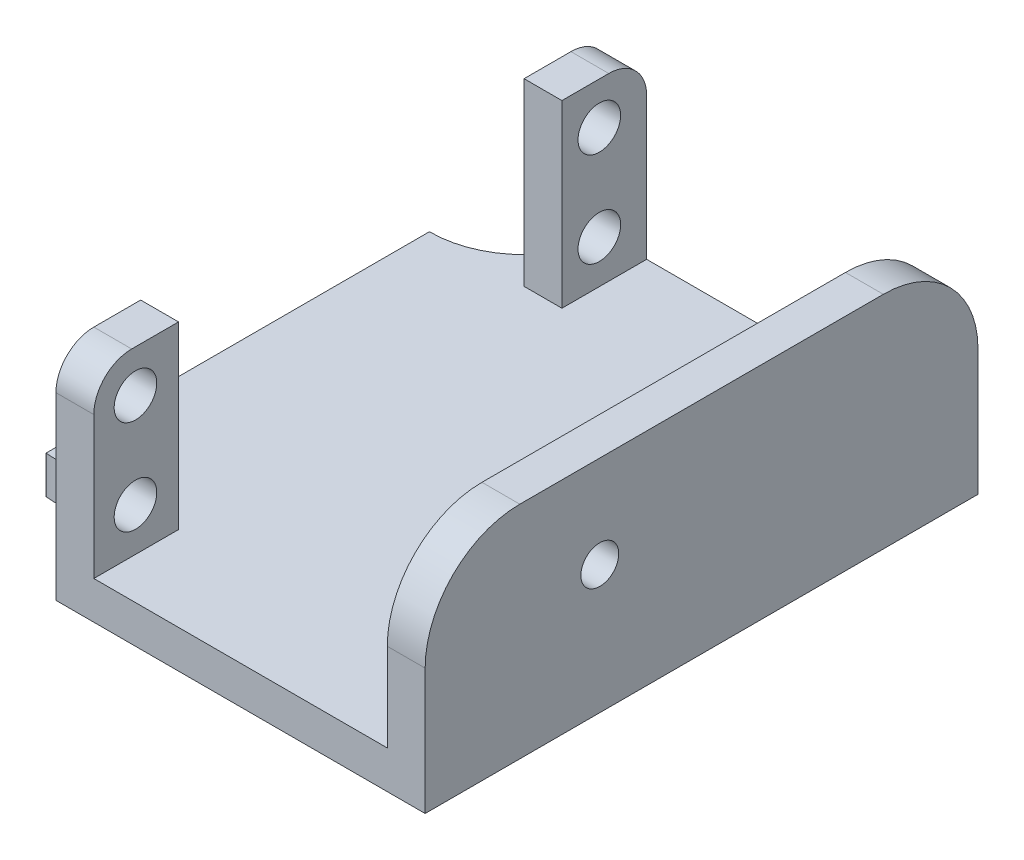
from build123d import *

# Parameters (mm, degrees)
BOSS_EXTRUDE1_DEPTH = 4
SKETCH2_W           = 8.95
SKETCH2_H           = 19
SKETCH2_R           = 2.25
BOSS_EXTRUDE2_DEPTH = 4
FILLET1_R           = 10
FILLET2_R           = 4
SKETCH3_W           = 58.4
SKETCH3_H           = 19.3
SKETCH3_R           = 2
BOSS_EXTRUDE3_DEPTH = 4
FILLET3_R           = 10


with BuildPart() as part:
    # Sketch1 → Boss-Extrude1 (new body)
    with BuildSketch(Plane(origin=(0, 0, 0), x_dir=(1, 0, 0), z_dir=(0, 1, 0))):
        Polygon((-49, 49.45), (-39, 49.45), (-39, 58.4), (0, 58.4), (0, 0), (-39, 0), (-39, 8.95), (-49, 8.95), align=None)
    extrude(amount=BOSS_EXTRUDE1_DEPTH)

    # Sketch2 → Boss-Extrude2 (add)
    # profile 1 of 2: a face of its own
    with BuildSketch(Plane.ZY.offset(39)):
        with Locations((-4.475, 13.5)):
            Rectangle(SKETCH2_W, SKETCH2_H)
        with Locations((-4.4, 18.55)):
            Circle(SKETCH2_R, mode=Mode.SUBTRACT)
        with Locations((-4.4, 8.55)):
            Circle(SKETCH2_R, mode=Mode.SUBTRACT)
    # profile 2 of 2: a face of its own
    with BuildSketch(Plane.ZY.offset(39)):
        with Locations((-53.925, 13.5)):
            Rectangle(SKETCH2_W, SKETCH2_H)
        with Locations((-53.4, 18.55)):
            Circle(SKETCH2_R, mode=Mode.SUBTRACT)
        with Locations((-53.4, 8.55)):
            Circle(SKETCH2_R, mode=Mode.SUBTRACT)
    extrude(amount=-BOSS_EXTRUDE2_DEPTH)

    # Fillet1
    # the kernel refuses this fillet: 10 mm, written as the material it adds along each edge
    with BuildSketch(Plane(origin=(-39, 0, -49.45), x_dir=(-1, 0, 0), z_dir=(0, 1, 0))) as fillet1_piece_1:
        with BuildLine():
            CenterArc((9.944722218, -10), FILLET1_R, 90, 83.97283344)
            Line((0, -8.95), (0, 0))
            Line((0, 0), (9.944722218, 0))
        make_face()
    extrude(amount=4)
    with BuildSketch(Plane(origin=(-39, 0, -8.95), x_dir=(0, 0, 1), z_dir=(0, 1, 0))) as fillet1_piece_2:
        with BuildLine():
            CenterArc((10, -9.944722218), FILLET1_R, 96.02716656, 83.97283344)
            Line((0, -9.944722218), (0, 0))
            Line((0, 0), (8.95, 0))
        make_face()
    extrude(amount=4)

    # Fillet2
    fillet2_edges = [part.edges().sort_by_distance(p)[0] for p in [
        (-37, 23, 0),
        (-37, 23, -58.4),
    ]]
    fillet(fillet2_edges, radius=FILLET2_R)

    # Sketch3 → Boss-Extrude3 (add)
    with BuildSketch(Plane(origin=(0, 0, 0), x_dir=(0, 0, -1), z_dir=(1, 0, 0))):
        with Locations((29.2, 13.65)):
            Rectangle(SKETCH3_W, SKETCH3_H)
        with Locations((18.45, 13.55)):
            Circle(SKETCH3_R, mode=Mode.SUBTRACT)
    extrude(amount=-BOSS_EXTRUDE3_DEPTH)

    # Fillet3
    fillet3_edges = [part.edges().sort_by_distance(p)[0] for p in [
        (-2, 23.3, 0),
        (-2, 23.3, -58.4),
    ]]
    fillet(fillet3_edges, radius=FILLET3_R)


solid = part.part
